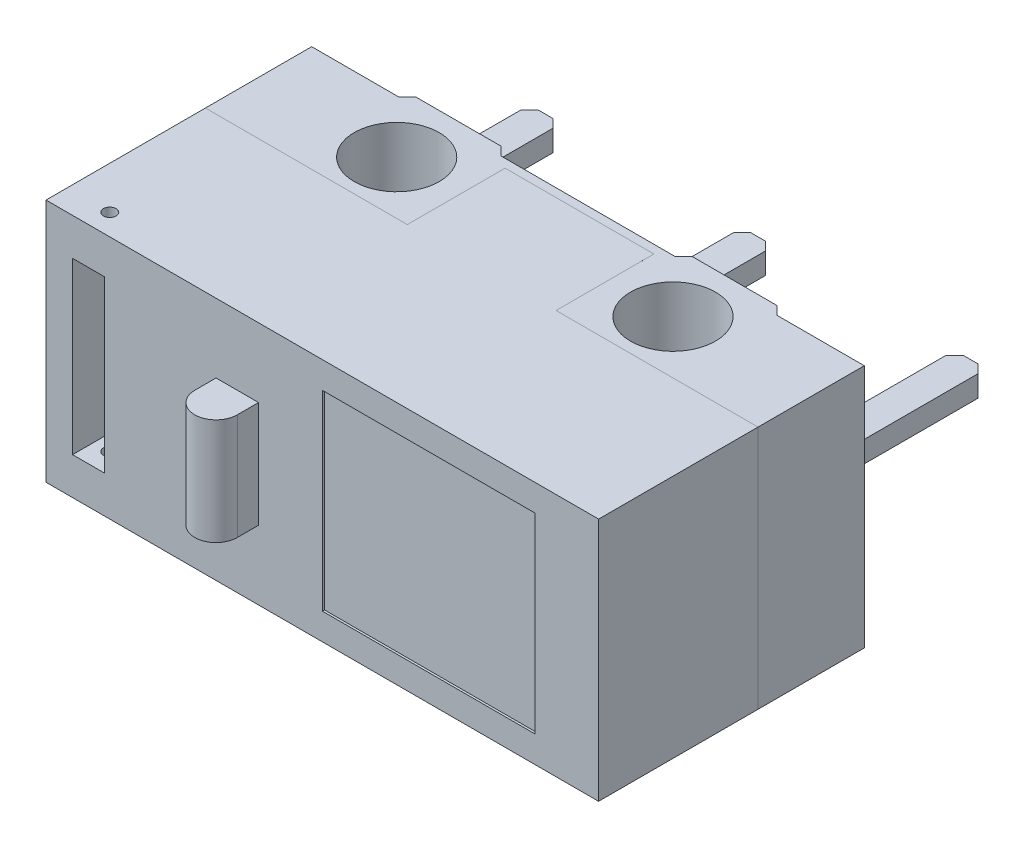
from build123d import *

# Parameters (mm, degrees)
SKETCH1_W            = 13
SKETCH1_H            = 5.75
BOSS_EXTRUDE1_DEPTH  = 2.5
SKETCH2_W            = 0.75
SKETCH2_H            = 0.5
BOSS_EXTRUDE2_DEPTH  = 4
CHAMFER1_SIZE        = 0.2
SKETCH4_R            = 1
CUT_EXTRUDE1_DEPTH   = 6
SKETCH5_W            = 2
SKETCH5_H            = 0.2
BOSS_EXTRUDE3_DEPTH  = 5.75
CHAMFER2_SIZE        = 0.2
SKETCH10_W           = 13.0002
SKETCH10_H           = 5.7502
BOSS_EXTRUDE8_DEPTH  = 3.75
SKETCH11_W           = 3.5
SKETCH11_H           = 2.3
BOSS_EXTRUDE9_DEPTH  = 0.5
SKETCH12_W           = 3.5
SKETCH12_H           = 2.3
BOSS_EXTRUDE10_DEPTH = 0.5
SKETCH13_W           = 1
SKETCH13_H           = 2.5
BOSS_EXTRUDE11_DEPTH = 1
FILLET2_RADIUS       = 0.5
FILLET2_LENGTH       = 2.5
SKETCH14_W           = 5
SKETCH14_H           = 4.5
CUT_EXTRUDE2_DEPTH   = 0.05
SKETCH15_R           = 0.15
CUT_EXTRUDE3_DEPTH   = 10
SKETCH16_W           = 0.75
SKETCH16_H           = 4
CUT_EXTRUDE4_DEPTH   = 1.2


with BuildPart() as part:
    # Sketch1 → Boss-Extrude1 (new body)
    with BuildSketch(Plane.XY):
        Rectangle(SKETCH1_W, SKETCH1_H)
    extrude(amount=BOSS_EXTRUDE1_DEPTH)

    # Sketch2 → Boss-Extrude2 (add)
    with BuildSketch(Plane(origin=(0, 0, 0), x_dir=(-1, 0, 0), z_dir=(0, 0, -1))):
        Rectangle(SKETCH2_W, SKETCH2_H)
        with Locations((-5, 0)):
            Rectangle(SKETCH2_W, SKETCH2_H)
        with Locations((5, 0)):
            Rectangle(SKETCH2_W, SKETCH2_H)
    extrude(amount=BOSS_EXTRUDE2_DEPTH)

    # Chamfer1
    chamfer1_edges = [part.edges().sort_by_distance(p)[0] for p in [
        (-0.375, 0, -4),
        (0.375, 0, -4),
        (4.625, 0, -4),
        (5.375, 0, -4),
        (-5.375, 0, -4),
        (-4.625, 0, -4),
    ]]
    chamfer(chamfer1_edges, length=CHAMFER1_SIZE)

    # Sketch4 → Cut-Extrude1 (cut)
    with BuildSketch(Plane(origin=(0, 2.875, 0), x_dir=(1, 0, 0), z_dir=(0, 1, 0))):
        with Locations(Location((-3.25, -1.25, 0), (0, 0, 270))):
            Circle(SKETCH4_R)
        with Locations(Location((3.25, -1.25, 0), (0, 0, 270))):
            Circle(SKETCH4_R)
    extrude(amount=-CUT_EXTRUDE1_DEPTH, mode=Mode.SUBTRACT)

    # Sketch5 → Boss-Extrude3 (add)
    with BuildSketch(Plane(origin=(0, 2.875, 0), x_dir=(1, 0, 0), z_dir=(0, 1, 0))):
        with Locations((-3.25, 0.1)):
            Rectangle(SKETCH5_W, SKETCH5_H)
        with Locations((3.25, 0.1)):
            Rectangle(SKETCH5_W, SKETCH5_H)
    extrude(amount=-BOSS_EXTRUDE3_DEPTH)

    # Chamfer2
    chamfer2_edges = [part.edges().sort_by_distance(p)[0] for p in [
        (4.25, 0, 0),
        (2.25, 0, 0),
        (-2.25, 0, 0),
        (-4.25, 0, 0),
    ]]
    chamfer(chamfer2_edges, length=CHAMFER2_SIZE - 0.0001)  # a hair under: the kernel refuses the full size

    # Sketch10 → Boss-Extrude8 (add)
    with BuildSketch(Plane.XY.offset(2.5)):
        Rectangle(SKETCH10_W, SKETCH10_H)
    extrude(amount=BOSS_EXTRUDE8_DEPTH)

    # Sketch11 → Boss-Extrude9 (add)
    with BuildSketch(Plane.XZ.offset(2.8751)):
        with Locations((0, 1.35)):
            Rectangle(SKETCH11_W, SKETCH11_H)
    extrude(amount=-BOSS_EXTRUDE9_DEPTH)

    # Sketch12 → Boss-Extrude10 (add)
    with BuildSketch(Plane(origin=(0, 2.8751, 0), x_dir=(1, 0, 0), z_dir=(0, 1, 0))):
        with Locations((0, -1.35)):
            Rectangle(SKETCH12_W, SKETCH12_H)
    extrude(amount=-BOSS_EXTRUDE10_DEPTH)

    # Sketch13 → Boss-Extrude11 (add)
    with BuildSketch(Plane.XY.offset(6.25)):
        with Locations((-1.9999, 0)):
            Rectangle(SKETCH13_W, SKETCH13_H)
    extrude(amount=BOSS_EXTRUDE11_DEPTH)

    # Fillet2: full round fillet: the end face becomes a half cylinder, R = half its width
    fillet2_face = Plane((-1.9999, 0, 7.25), x_dir=(0, -1, 0), z_dir=(0, 0, 1))  # on the end face: x along it, z out of the body
    fillet2_slab = fillet2_face.offset(-FILLET2_RADIUS / 2) * Box(FILLET2_LENGTH, 2 * FILLET2_RADIUS, FILLET2_RADIUS, mode=Mode.PRIVATE)  # the body's end, R deep
    fillet2_round = Plane((-1.9999, 0, 6.75), x_dir=(0, 0, 1), z_dir=(0, -1, 0)) * Cylinder(FILLET2_RADIUS, FILLET2_LENGTH, mode=Mode.PRIVATE)  # its axis R under the face
    add(fillet2_slab - fillet2_round, mode=Mode.SUBTRACT)

    # Sketch14 → Cut-Extrude2 (cut)
    with BuildSketch(Plane.XY.offset(6.25)):
        with Locations((2.5001, 0)):
            Rectangle(SKETCH14_W, SKETCH14_H)
    extrude(amount=-CUT_EXTRUDE2_DEPTH, mode=Mode.SUBTRACT)

    # Sketch15 → Cut-Extrude3 (cut)
    with BuildSketch(Plane(origin=(0, 2.8751, 0), x_dir=(1, 0, 0), z_dir=(0, 1, 0))):
        with Locations(Location((-5.500093333, -5.75, 0), (0, 0, 270))):
            Circle(SKETCH15_R)
    extrude(amount=-CUT_EXTRUDE3_DEPTH, mode=Mode.SUBTRACT)

    # Sketch16 → Cut-Extrude4 (cut)
    with BuildSketch(Plane.XY.offset(6.25)):
        with Locations((-5.5001, 0)):
            Rectangle(SKETCH16_W, SKETCH16_H)
    extrude(amount=-CUT_EXTRUDE4_DEPTH, mode=Mode.SUBTRACT)


solid = part.part
